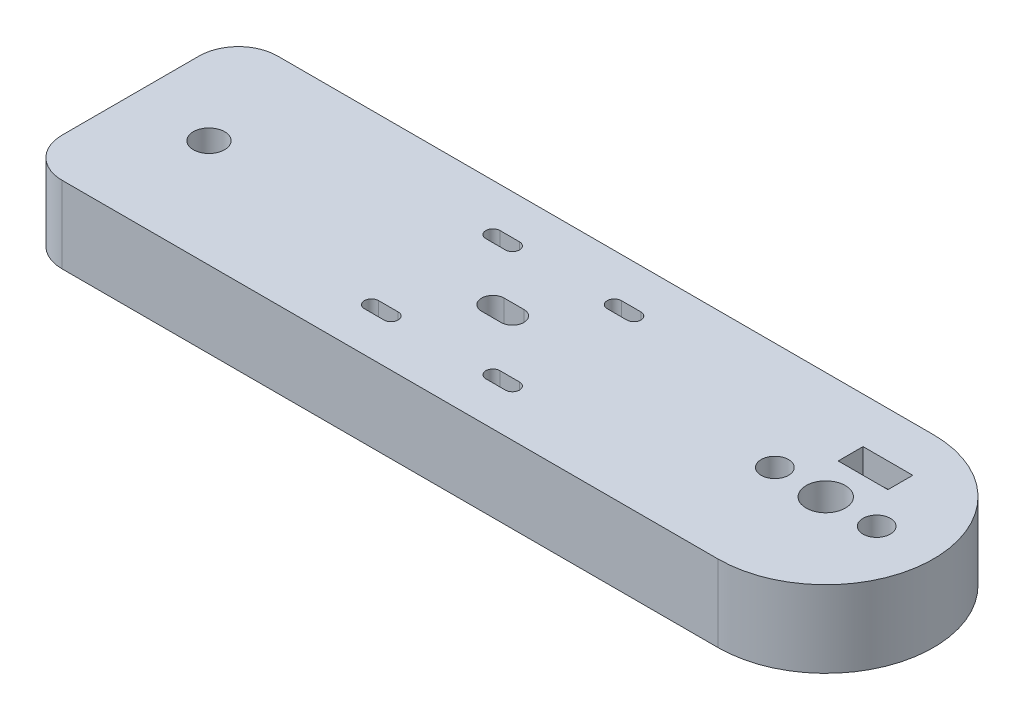
from build123d import *

# Parameters (mm, degrees)
SKETCH1_W                       = 150
SKETCH1_H                       = 55
BOSS_EXTRUDE1_DEPTH             = 19.6
SKETCH2_W                       = 27.5
SKETCH2_H                       = 55
BOSS_EXTRUDE2_DEPTH             = 19.6
M8_CLEARANCE_HOLE1_D            = 10
M6_CLEARANCE_HOLE1_D            = 7
FILLET1_R                       = 10
SKETCH11_W                      = 42.4
SKETCH11_H                      = 42.4
CUT_EXTRUDE1_DEPTH              = 10.6
SKETCH13_W                      = 1.8
SKETCH13_H                      = 9
M3_CLEARANCE_HOLE1_AT_2_COUNT   = 2
M3_CLEARANCE_HOLE1_AT_2_PITCH   = 31
M3_CLEARANCE_HOLE1_AT_3_COUNT   = 2
M3_CLEARANCE_HOLE1_AT_3_PITCH   = 43.840620434
M3_CLEARANCE_HOLE1_AT_4_COUNT   = 2
M3_CLEARANCE_HOLE1_AT_4_PITCH   = 31
M3_CLEARANCE_HOLE1_AT_5_COUNT   = 2
M3_CLEARANCE_HOLE1_AT_5_PITCH   = 21.920310217
M3_CLEARANCE_HOLE1_AT_6_COUNT   = 2
M3_CLEARANCE_HOLE1_AT_6_PITCH   = 5
M3_CLEARANCE_HOLE1_AT_7_COUNT   = 2
M3_CLEARANCE_HOLE1_AT_7_PITCH   = 31.400636936
M3_CLEARANCE_HOLE1_AT_8_COUNT   = 2
M3_CLEARANCE_HOLE1_AT_8_PITCH   = 40.459856648
M3_CLEARANCE_HOLE1_AT_9_COUNT   = 2
M3_CLEARANCE_HOLE1_AT_9_PITCH   = 26
M5_CLEARANCE_HOLE1_D            = 5.8
SKETCH17_R                      = 4
CUT_EXTRUDE2_DEPTH              = 108.919692364
SKETCH18_W                      = 0.2
SKETCH18_H                      = 42.4
SKETCH18_W_2                    = 5
SKETCH18_H_2                    = 0.2
CUT_EXTRUDE3_DEPTH              = 10.6
SKETCH19_W                      = 5
SKETCH19_H                      = 5.8
SKETCH19_H_2                    = 3.6
CUT_EXTRUDE4_DEPTH              = 107.652988706
CUT_EXTRUDE5_DEPTH              = 2
SKETCH21_W                      = 12.7
SKETCH21_H                      = 6.35
CUT_EXTRUDE6_DEPTH              = 108.919692364
F_1_4_CLEARANCE_HOLE1_OUTLINE_W = 3.57124
F_1_4_CLEARANCE_HOLE1_OUTLINE_H = 11.625002241


# Read off the part's stored shape, not the designer's step: 1/4 Clearance Hole1
with BuildPart() as part:
    # Sketch1 → Boss-Extrude1 (new body)
    with BuildSketch(Plane(origin=(0, 0, 0), x_dir=(1, 0, 0), z_dir=(0, 1, 0))):
        Rectangle(SKETCH1_W, SKETCH1_H)
    extrude(amount=BOSS_EXTRUDE1_DEPTH)

    # Sketch2 → Boss-Extrude2 (add)
    with BuildSketch(Plane.XZ):
        with Locations((-88.75, 0)):
            Rectangle(SKETCH2_W, SKETCH2_H)
        with BuildLine():
            Line((75, 27.5), (75, -27.5))
            ThreePointArc((75, -27.5), (102.5, 0), (75, 27.5))
        make_face()
    extrude(amount=-BOSS_EXTRUDE2_DEPTH)

    # M8 Clearance Hole1 (through all)
    with Locations(Plane(origin=(0, 0, 0), x_dir=(-1, 0, 0), z_dir=(0, -1, 0))):
        with Locations((-75, 0)):
            Hole(M8_CLEARANCE_HOLE1_D / 2)

    # M6 Clearance Hole1 (through all)
    with Locations(Plane(origin=(0, 19.6, 0), x_dir=(1, 0, 0), z_dir=(0, 1, 0))):
        with Locations((62, 0), (88, 0)):
            Hole(M6_CLEARANCE_HOLE1_D / 2)

    # Fillet1
    fillet1_edges = [part.edges().sort_by_distance(p)[0] for p in [
        (-102.5, 9.8, -27.5),
        (-102.5, 9.8, 27.5),
    ]]
    fillet(fillet1_edges, radius=FILLET1_R)

    # Sketch11 → Cut-Extrude1 (cut)
    with BuildSketch(Plane.XZ):
        with Locations((-10, 0)):
            Rectangle(SKETCH11_W, SKETCH11_H)
    extrude(amount=-CUT_EXTRUDE1_DEPTH, mode=Mode.SUBTRACT)

    # Sketch13 → M3 Clearance Hole1 (revolve, cut)
    with BuildSketch(Plane(origin=(5.5, 10.6, -15.5), x_dir=(0, 0, -1), z_dir=(1, 0, 0))):
        with Locations((0.9, 4.5)):
            Rectangle(SKETCH13_W, SKETCH13_H)
    m3_clearance_hole1 = revolve(axis=Axis((5.5, 4.25, -15.5), (0, 1, 0)), mode=Mode.SUBTRACT)

    # M3 Clearance Hole1 at 2: M3 Clearance Hole1 ×2
    with Locations(*[(-i * M3_CLEARANCE_HOLE1_AT_2_PITCH, 0, 0) for i in range(1, M3_CLEARANCE_HOLE1_AT_2_COUNT)]):
        add(m3_clearance_hole1, mode=Mode.SUBTRACT)

    # M3 Clearance Hole1 at 3: M3 Clearance Hole1 ×2
    with Locations(*[Vector(-0.7071067811865476, 0, 0.7071067811865476) * (i * M3_CLEARANCE_HOLE1_AT_3_PITCH) for i in range(1, M3_CLEARANCE_HOLE1_AT_3_COUNT)]):
        add(m3_clearance_hole1, mode=Mode.SUBTRACT)

    # M3 Clearance Hole1 at 4: M3 Clearance Hole1 ×2
    with Locations(*[(0, 0, i * M3_CLEARANCE_HOLE1_AT_4_PITCH) for i in range(1, M3_CLEARANCE_HOLE1_AT_4_COUNT)]):
        add(m3_clearance_hole1, mode=Mode.SUBTRACT)

    # M3 Clearance Hole1 at 5: M3 Clearance Hole1 ×2
    with Locations(*[Vector(-0.7071067811865476, 0, 0.7071067811865476) * (i * M3_CLEARANCE_HOLE1_AT_5_PITCH) for i in range(1, M3_CLEARANCE_HOLE1_AT_5_COUNT)]):
        add(m3_clearance_hole1, mode=Mode.SUBTRACT)

    # M3 Clearance Hole1 at 6: M3 Clearance Hole1 ×2
    with Locations(*[(i * M3_CLEARANCE_HOLE1_AT_6_PITCH, 0, 0) for i in range(1, M3_CLEARANCE_HOLE1_AT_6_COUNT)]):
        add(m3_clearance_hole1, mode=Mode.SUBTRACT)

    # M3 Clearance Hole1 at 7: M3 Clearance Hole1 ×2
    with Locations(*[Vector(0.15923243882462054, 0, 0.9872411207126471) * (i * M3_CLEARANCE_HOLE1_AT_7_PITCH) for i in range(1, M3_CLEARANCE_HOLE1_AT_7_COUNT)]):
        add(m3_clearance_hole1, mode=Mode.SUBTRACT)

    # M3 Clearance Hole1 at 8: M3 Clearance Hole1 ×2
    with Locations(*[Vector(-0.6426122619764711, 0, 0.7661915431257925) * (i * M3_CLEARANCE_HOLE1_AT_8_PITCH) for i in range(1, M3_CLEARANCE_HOLE1_AT_8_COUNT)]):
        add(m3_clearance_hole1, mode=Mode.SUBTRACT)

    # M3 Clearance Hole1 at 9: M3 Clearance Hole1 ×2
    with Locations(*[(-i * M3_CLEARANCE_HOLE1_AT_9_PITCH, 0, 0) for i in range(1, M3_CLEARANCE_HOLE1_AT_9_COUNT)]):
        add(m3_clearance_hole1, mode=Mode.SUBTRACT)

    # M5 Clearance Hole1 (through all)
    with Locations(Plane(origin=(0, 10.6, 0), x_dir=(-1, 0, 0), z_dir=(0, -1, 0))):
        with Locations((10, 0), (5, 0)):
            Hole(M5_CLEARANCE_HOLE1_D / 2)

    # Sketch17 → Cut-Extrude2 (cut, through all)
    with BuildSketch(Plane.XZ):
        with Locations(Location((-82.5, 0, 0), (0, 0, 270))):
            Circle(SKETCH17_R)
    extrude(amount=-CUT_EXTRUDE2_DEPTH, mode=Mode.SUBTRACT)

    # Sketch18 → Cut-Extrude3 (cut)
    with BuildSketch(Plane.XZ):
        with Locations((-31.3, 0)):
            Rectangle(SKETCH18_W, SKETCH18_H)
        Polygon((11.2, -21.2), (-31.2, -21.2), (-31.4, -21.2), (-31.4, -21.4), (11.2, -21.4), align=None)
        with Locations((13.7, -21.3)):
            Rectangle(SKETCH18_W_2, SKETCH18_H_2)
        Polygon((11.2, 21.4), (11.2, 21.2), (11.2, -21.2), (16.2, -21.2), (16.2, 21.4), align=None)
        Polygon((-31.4, 21.2), (-31.2, 21.2), (11.2, 21.2), (11.2, 21.4), (-31.4, 21.4), align=None)
    extrude(amount=-CUT_EXTRUDE3_DEPTH, mode=Mode.SUBTRACT)

    # Sketch19 → Cut-Extrude4 (cut, through all)
    with BuildSketch(Plane.XZ.offset(-10.6)):
        with BuildLine():
            ThreePointArc((-20.5, 13.7), (-22.3, 15.5), (-20.5, 17.3))
            Line((-20.5, 17.3), (-25.5, 17.3))
            ThreePointArc((-25.5, 17.3), (-24.227207794, 16.772792206), (-23.7, 15.5))
            ThreePointArc((-23.7, 15.5), (-24.227207794, 14.227207794), (-25.5, 13.7))
            Line((-25.5, 13.7), (-20.5, 13.7))
        make_face()
        with BuildLine():
            ThreePointArc((10.5, 13.7), (8.7, 15.5), (10.5, 17.3))
            Line((10.5, 17.3), (5.5, 17.3))
            ThreePointArc((5.5, 17.3), (6.772792206, 16.772792206), (7.3, 15.5))
            ThreePointArc((7.3, 15.5), (6.772792206, 14.227207794), (5.5, 13.7))
            Line((5.5, 13.7), (10.5, 13.7))
        make_face()
        with Locations((-7.5, 0)):
            Rectangle(SKETCH19_W, SKETCH19_H)
        with Locations((8, -15.5)):
            Rectangle(SKETCH19_W, SKETCH19_H_2)
        with Locations((-23, -15.5)):
            Rectangle(SKETCH19_W, SKETCH19_H_2)
    extrude(amount=-CUT_EXTRUDE4_DEPTH, mode=Mode.SUBTRACT)

    # Sketch16 → Cut-Extrude5 (cut)
    with BuildSketch(Plane.XZ.offset(-10.6)):
        with BuildLine():
            Line((-10, 11.2), (-5, 11.2))
            ThreePointArc((-5, 11.2), (6.2, 0), (-5, -11.2))
            Line((-5, -11.2), (-10, -11.2))
            ThreePointArc((-10, -11.2), (-21.2, 0), (-10, 11.2))
        make_face()
    extrude(amount=-CUT_EXTRUDE5_DEPTH, mode=Mode.SUBTRACT)

    # Sketch21 → Cut-Extrude6 (cut, through all)
    with BuildSketch(Plane(origin=(0, 19.6, 0), x_dir=(1, 0, 0), z_dir=(0, 1, 0))):
        with Locations((75, 12.7)):
            Rectangle(SKETCH21_W, SKETCH21_H)
    extrude(amount=-CUT_EXTRUDE6_DEPTH, mode=Mode.SUBTRACT)

    # 1/4 Clearance Hole1 outline → 1/4 Clearance Hole1 (revolve, cut)
    with BuildSketch(Plane(origin=(75, 9.8, 0), x_dir=(1, 0, 0), z_dir=(0, -1, 0))):
        Polygon((2.477440343, -4.342778861), (0, -4.342778861), (0, -9.525), (3.57124, -9.525), (3.571240952, -5.000000572), align=None)
        with Locations((1.78562, -21.687501121)):
            Rectangle(F_1_4_CLEARANCE_HOLE1_OUTLINE_W, F_1_4_CLEARANCE_HOLE1_OUTLINE_H)
    revolve(axis=Axis((75, 9.8, 0), (0, 0, 1)), mode=Mode.SUBTRACT)


solid = part.part
